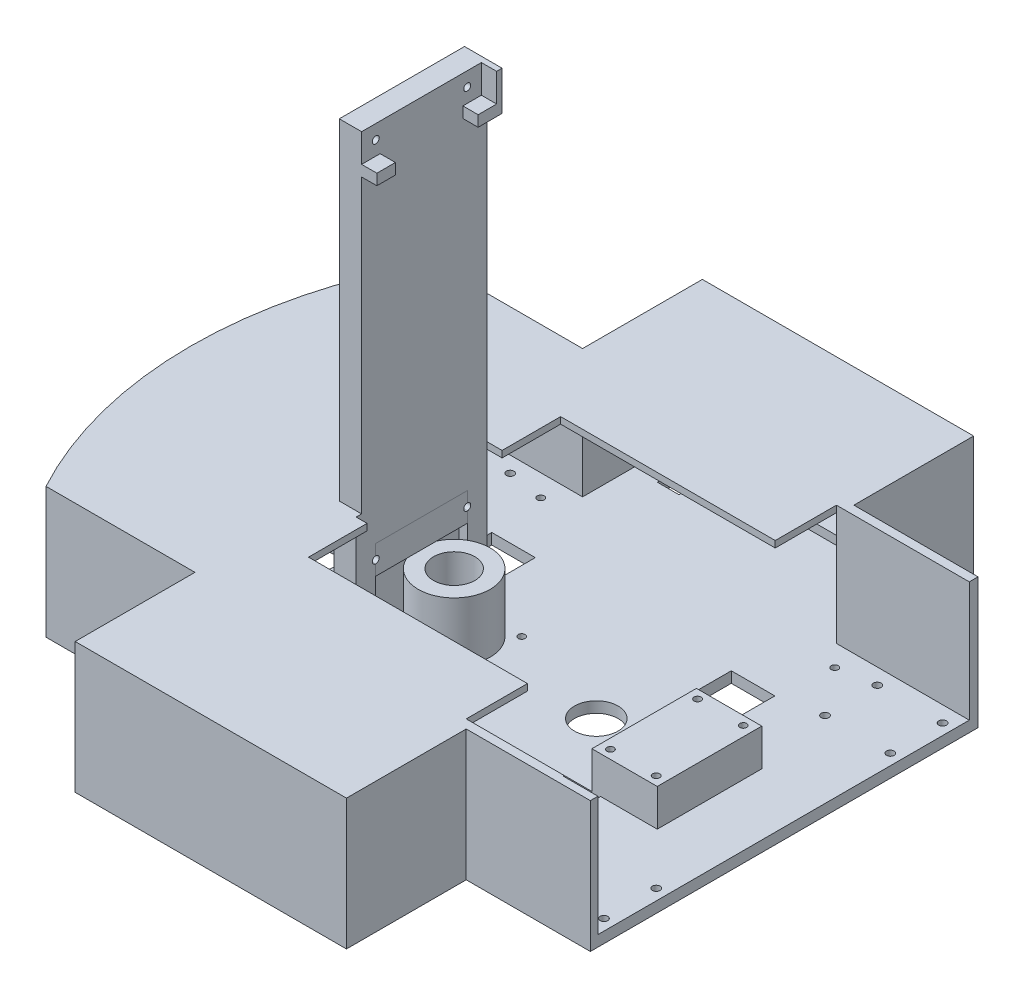
from build123d import *
from build123d.topology import SkipClean

# Parameters (mm, degrees)
SKETCH_1_R                  = 1.75
EXTRUDE_1_DEPTH             = 5
SKETCH_2_W                  = 20
SKETCH_2_H                  = 20
CUT_EXTRUDE_1_DEPTH         = 205.697931991
CUT_EXTRUDE_3_DEPTH         = 205.697931991
CUT_EXTRUDE_3_DEPTH_BACK    = 205.697931991
SKETCH_4_R                  = 1.6
CUT_EXTRUDE_4_DEPTH         = 205.697931991
CUT_EXTRUDE_4_DEPTH_BACK    = 205.697931991
SKETCH_5_R                  = 11
SKETCH_5_R_2                = 1.6
EXTRUDE_2_DEPTH             = 23.8
SKETCH_9_R                  = 16.5
SKETCH_9_R_2                = 11
EXTRUDE_3_DEPTH             = 2
SKETCH_10_R                 = 16.5
SKETCH_10_R_2               = 9.5
EXTRUDE_4_DEPTH             = 25
SKETCH_11_W                 = 10.25
SKETCH_11_H                 = 55
EXTRUDE_5_DEPTH             = 40
CUT_EXTRUDE_7_DEPTH         = 215.351774803
CUT_EXTRUDE_7_DEPTH_BACK    = 40
EXTRUDE_6_OUTLINE_W         = 42.3
EXTRUDE_6_OUTLINE_H         = 13
EXTRUDE_6_DEPTH             = 4
SKETCH_14_4_R               = 1.6
CUT_EXTRUDE_8_DEPTH         = 4
EXTRUDE_8_REACH             = 211.526
SKETCH_17_W                 = 10.25
SKETCH_17_H                 = 167
EXTRUDE_8_DIRECTION_2_REACH = 211.526
CUT_EXTRUDE_9_DEPTH         = 322.182257959
CUT_EXTRUDE_9_DEPTH_BACK    = 322.182257959
SKETCH_18_R                 = 1.6
SKETCH_21_W                 = 10.25
SKETCH_21_H                 = 2.5
EXTRUDE_9_DEPTH             = 207
EXTRUDE_10_DEPTH            = 7
SKETCH_24_W                 = 38
SKETCH_24_H                 = 5
CUT_EXTRUDE_11_DEPTH        = 7
EXTRUDE_START               = -5
EXTRUDE_11_DEPTH            = 60
SKETCH_28_R                 = 10
CUT_EXTRUDE_12_DEPTH        = 60
CUT_EXTRUDE_13_DEPTH        = 326.395266288
CUT_EXTRUDE_13_DEPTH_BACK   = 326.395266288
SKETCH_30_W                 = 70
SKETCH_30_H                 = 157
CUT_EXTRUDE_15_DEPTH        = 55
SKETCH_31_W                 = 65
SKETCH_31_H                 = 154
CUT_EXTRUDE_17_DEPTH        = 10
SKETCH_32_R                 = 1.6
CUT_EXTRUDE_18_DEPTH        = 10
EXTRUDE_START_2             = 17
SKETCH_32_3_W               = 30
SKETCH_32_3_H               = 48
SKETCH_32_3_R               = 1.6
EXTRUDE_12_DEPTH            = 17
CUT_EXTRUDE_START           = -78.8
SKETCH_33_W                 = 25.229470945
SKETCH_33_H                 = 5.5
CUT_EXTRUDE_19_DEPTH        = 230.8
CUT_EXTRUDE_21_DEPTH        = 296.078399089
CUT_EXTRUDE_21_DEPTH_BACK   = 296.078399089
SKETCH_36_W                 = 40
SKETCH_36_H                 = 4
SKETCH_36_W_2               = 10
SKETCH_36_H_2               = 20
EXTRUDE_13_DEPTH            = 3
SKETCH_41_W                 = 16.449480849
SKETCH_41_H                 = 36.538138877
SKETCH_41_W_2               = 17.593682818
SKETCH_41_H_2               = 32.002178069
CUT_EXTRUDE_23_DEPTH        = 60
CUT_EXTRUDE_24_DEPTH        = 260.473046016
CUT_EXTRUDE_24_DEPTH_BACK   = 260.473046016
SKETCH_42_W                 = 21.982294934
SKETCH_42_H                 = 16.041134141


# Read off the part's stored shape, not the designer's step: 凸台-拉伸6
with BuildPart() as part:
    # 草图1 → 凸台-拉伸1 (new body)
    with BuildSketch(Plane(origin=(0, 0, 0), x_dir=(1, 0, 0), z_dir=(0, 1, 0))):
        with BuildLine():
            Line((-62.281940226, 140), (-62.281940226, 85))
            Line((-62.281940226, 85), (-128.281940226, 85))
            ThreePointArc((-128.281940226, 85), (-149.252280925, 0), (-128.281940226, -85))
            Line((-128.281940226, -85), (-62.281940226, -85))
            Line((-62.281940226, -85), (-62.281940226, -140))
            Line((-62.281940226, -140), (62.281940226, -140))
            Line((62.281940226, -140), (62.281940226, -85))
            Line((62.281940226, -85), (128.281940226, -85))
            ThreePointArc((128.281940226, -85), (149.252280925, 0), (128.281940226, 85))
            Line((128.281940226, 85), (62.281940226, 85))
            Line((62.281940226, 85), (62.281940226, 140))
            Line((62.281940226, 140), (0, 140))
            Line((0, 140), (-62.281940226, 140))
        make_face()
        with Locations(Location((-84.281940226, 77.75, 0), (0, 0, 270))):
            Circle(SKETCH_1_R, mode=Mode.SUBTRACT)
        with Locations(Location((-114.281940226, 77.75, 0), (0, 0, 270))):
            Circle(SKETCH_1_R, mode=Mode.SUBTRACT)
        with Locations(Location((-114.281940226, 53.75, 0), (0, 0, 270))):
            Circle(SKETCH_1_R, mode=Mode.SUBTRACT)
        with Locations(Location((-84.281940226, 53.75, 0), (0, 0, 270))):
            Circle(SKETCH_1_R, mode=Mode.SUBTRACT)
        with Locations(Location((-84.281940226, -53.75, 0), (0, 0, 90))):
            Circle(SKETCH_1_R, mode=Mode.SUBTRACT)
        with Locations(Location((-114.281940226, -53.75, 0), (0, 0, 90))):
            Circle(SKETCH_1_R, mode=Mode.SUBTRACT)
        with Locations(Location((-114.281940226, -77.75, 0), (0, 0, 90))):
            Circle(SKETCH_1_R, mode=Mode.SUBTRACT)
        with Locations(Location((-84.281940226, -77.75, 0), (0, 0, 90))):
            Circle(SKETCH_1_R, mode=Mode.SUBTRACT)
        with Locations(Location((84.281940226, -77.75, 0), (0, 0, 270))):
            Circle(SKETCH_1_R, mode=Mode.SUBTRACT)
        with Locations(Location((114.281940226, -77.75, 0), (0, 0, 270))):
            Circle(SKETCH_1_R, mode=Mode.SUBTRACT)
        with Locations(Location((114.281940226, -53.75, 0), (0, 0, 270))):
            Circle(SKETCH_1_R, mode=Mode.SUBTRACT)
        with Locations(Location((84.281940226, -53.75, 0), (0, 0, 270))):
            Circle(SKETCH_1_R, mode=Mode.SUBTRACT)
        with Locations(Location((84.281940226, 53.75, 0), (0, 0, 90))):
            Circle(SKETCH_1_R, mode=Mode.SUBTRACT)
        with Locations(Location((114.281940226, 53.75, 0), (0, 0, 90))):
            Circle(SKETCH_1_R, mode=Mode.SUBTRACT)
        with Locations(Location((114.281940226, 77.75, 0), (0, 0, 90))):
            Circle(SKETCH_1_R, mode=Mode.SUBTRACT)
        with Locations(Location((84.281940226, 77.75, 0), (0, 0, 90))):
            Circle(SKETCH_1_R, mode=Mode.SUBTRACT)
    extrude(amount=EXTRUDE_1_DEPTH)

    # 草图2 → 切除-拉伸1 (cut, through all)
    with BuildSketch(Plane(origin=(0, 5, 0), x_dir=(1, 0, 0), z_dir=(0, 1, 0))):
        with Locations((-55, -40)):
            Rectangle(SKETCH_2_W, SKETCH_2_H)
        with Locations((-55, 40)):
            Rectangle(SKETCH_2_W, SKETCH_2_H)
        with Locations((55, -40)):
            Rectangle(SKETCH_2_W, SKETCH_2_H)
        with Locations((55, 40)):
            Rectangle(SKETCH_2_W, SKETCH_2_H)
    extrude(amount=-CUT_EXTRUDE_1_DEPTH, mode=Mode.SUBTRACT)

    # 草图4 → 切除-拉伸3 (cut, two sides: drawn at the far end of the back side and taken through both)
    with BuildSketch(Plane.XZ.offset(-CUT_EXTRUDE_3_DEPTH_BACK)):
        with Locations(Location((-67.5, 75, 0), (0, 0, 270))):
            Circle(SKETCH_4_R)
        with Locations(Location((67.5, 75, 0), (0, 0, 270))):
            Circle(SKETCH_4_R)
        with Locations(Location((-67.5, -75, 0), (0, 0, 270))):
            Circle(SKETCH_4_R)
        with Locations(Location((67.5, -75, 0), (0, 0, 270))):
            Circle(SKETCH_4_R)
    extrude(amount=CUT_EXTRUDE_3_DEPTH + CUT_EXTRUDE_3_DEPTH_BACK, mode=Mode.SUBTRACT)

    # 草图5 → 切除-拉伸4 (cut, two sides: drawn at the far end of the back side and taken through both)
    with BuildSketch(Plane.XZ.offset(-CUT_EXTRUDE_4_DEPTH_BACK)):
        with Locations(Location((-32.252280925, 0, 0), (0, 0, 270))):
            Circle(SKETCH_5_R)
        with Locations(Location((-16.752280925, -15.5, 0), (0, 0, 270))):
            Circle(SKETCH_5_R_2)
        with Locations(Location((-47.752280925, -15.5, 0), (0, 0, 270))):
            Circle(SKETCH_5_R_2)
        with Locations(Location((-47.752280925, 15.5, 0), (0, 0, 270))):
            Circle(SKETCH_5_R_2)
        with Locations(Location((-16.752280925, 15.5, 0), (0, 0, 270))):
            Circle(SKETCH_5_R_2)
    extrude(amount=CUT_EXTRUDE_4_DEPTH + CUT_EXTRUDE_4_DEPTH_BACK, mode=Mode.SUBTRACT)



with BuildPart() as body_2:
    # 草图6 → 凸台-拉伸2 (new body)
    with BuildSketch(Plane(origin=(0, 5, 0), x_dir=(1, 0, 0), z_dir=(0, 1, 0))):
        Polygon((-57.502280925, 21.25), (-53.502280925, 21.25), (-11.002280925, 21.25), (-11.002280925, -21.25), (-53.502280925, -21.25), (-57.502280925, -21.25), (-57.502280925, -25.25), (-7.002280925, -25.25), (-7.002280925, 25.25), (-57.502280925, 25.25), align=None)
    extrude(amount=-EXTRUDE_2_DEPTH)


with BuildPart() as part_1:
    with SkipClean():  # the faces are left unmerged after this step: merging them gives an invalid solid
        add(part.part)

        add(body_2.part)  # 凸台-拉伸3 merges body 2
        # 草图9 → 凸台-拉伸3 (add)
        with BuildSketch(Plane(origin=(0, 5, 0), x_dir=(1, 0, 0), z_dir=(0, 1, 0))):
            with Locations(Location((-32.252280925, 0, 0), (0, 0, 270))):
                Circle(SKETCH_9_R)
            with Locations(Location((-32.252280925, 0, 0), (0, 0, 270))):
                Circle(SKETCH_9_R_2, mode=Mode.SUBTRACT)
        extrude(amount=EXTRUDE_3_DEPTH)

    # 草图10 → 凸台-拉伸4 (add)
    with SkipClean():  # the faces are left unmerged after this step: merging them gives an invalid solid
        with BuildSketch(Plane(origin=(0, 7, 0), x_dir=(1, 0, 0), z_dir=(0, 1, 0))):
            with Locations(Location((-32.252280925, 0, 0), (0, 0, 270))):
                Circle(SKETCH_10_R)
            with Locations(Location((-32.252280925, 0, 0), (0, 0, 270))):
                Circle(SKETCH_10_R_2, mode=Mode.SUBTRACT)
        extrude(amount=EXTRUDE_4_DEPTH)

    # 草图11 → 凸台-拉伸5 (add)
    with SkipClean():  # the faces are left unmerged after this step: merging them gives an invalid solid
        with BuildSketch(Plane(origin=(0, 5, 0), x_dir=(1, 0, 0), z_dir=(0, 1, 0))):
            with Locations((-52.377280925, 0)):
                Rectangle(SKETCH_11_W, SKETCH_11_H)
        extrude(amount=EXTRUDE_5_DEPTH)

    # 草图13 → 切除-拉伸7 (cut, two sides: drawn at the far end of the back side and taken through both)
    with SkipClean():  # the faces are left unmerged after this step: merging them gives an invalid solid
        with BuildSketch(Plane(origin=(0, 45, 0), x_dir=(1, 0, 0), z_dir=(0, 1, 0)).offset(-CUT_EXTRUDE_7_DEPTH_BACK)):
            Polygon((-51.252280925, 21.15), (-51.252280925, 0), (-47.252280925, 0), (-47.252280925, 13.980131585), (-47.252280925, 17.019868415), (-47.252280925, 21.15), align=None)
            Polygon((-47.252280925, 0), (-51.252280925, 0), (-51.252280925, -21.15), (-47.252280925, -21.15), (-47.252280925, -17.019868415), (-47.252280925, -13.980131585), align=None)
        extrude(amount=CUT_EXTRUDE_7_DEPTH + CUT_EXTRUDE_7_DEPTH_BACK, mode=Mode.SUBTRACT)


with BuildPart() as body_2_2:
    # 凸台-拉伸6 outline → 凸台-拉伸6 (new body)
    with BuildSketch(Plane(origin=(-51.252280925, 0, 0), x_dir=(0, 0, -1), z_dir=(1, 0, 0))):
        with Locations((0, 38.5)):
            Rectangle(EXTRUDE_6_OUTLINE_W, EXTRUDE_6_OUTLINE_H)
    extrude(amount=EXTRUDE_6_DEPTH)


with BuildPart() as cut_extrude_8_tool:
    # 草图14<4> → 切除-拉伸8 (new body)
    with SkipClean():  # the faces are left unmerged after this step: merging them gives an invalid solid
        with BuildSketch(Plane(origin=(-51.252280925, 0, 0), x_dir=(0, 0, -1), z_dir=(1, 0, 0))):
            with Locations((-21, 38.5)):
                Circle(SKETCH_14_4_R)
            with Locations((21, 38.5)):
                Circle(SKETCH_14_4_R)
        extrude(amount=CUT_EXTRUDE_8_DEPTH)


with BuildPart() as part_2:
    with SkipClean():  # the faces are left unmerged after this step: merging them gives an invalid solid
        add(part_1.part)

        # 切除-拉伸8: cut by cut_extrude_8_tool
        add(cut_extrude_8_tool.part, mode=Mode.SUBTRACT)


with BuildPart() as body_2_2_1:
    with SkipClean():  # the faces are left unmerged after this step: merging them gives an invalid solid
        add(body_2_2.part)

        # 切除-拉伸8: cut by cut_extrude_8_tool
        add(cut_extrude_8_tool.part, mode=Mode.SUBTRACT)


with BuildPart() as body_3:

    # 凸台-拉伸8: up to this face of the body (flat: up to its plane)
    extrude_8_end = Plane(part_2.part.faces().sort_by_distance((-52.377280925, 25, 27.5))[0])
    # 草图17 → 凸台-拉伸8 (new, up to the picked face)
    with BuildSketch(Plane.XY, mode=Mode.PRIVATE) as extrude_8_sk1:
        with Locations((-52.377280925, 128.5)):
            Rectangle(SKETCH_17_W, SKETCH_17_H)
    extrude_8_tool1 = split(extrude(extrude_8_sk1.sketch, amount=EXTRUDE_8_REACH, mode=Mode.PRIVATE), bisect_by=extrude_8_end, keep=Keep.BOTH, mode=Mode.PRIVATE)
    add(extrude_8_tool1.solids().sort_by(Axis((-52.377281, 128.5, 0), (0, 0, 1)))[0])


    # 凸台-拉伸8 direction 2: up to this face of the body (flat: up to its plane)
    extrude_8_direction_2_end = Plane(part_2.part.faces().sort_by_distance((-52.377280925, 25, -27.5))[0])
    # 草图17 → 凸台-拉伸8 direction 2 (add, up to the picked face)
    with BuildSketch(Plane.XY, mode=Mode.PRIVATE) as extrude_8_direction_2_sk1:
        with Locations((-52.377280925, 128.5)):
            Rectangle(SKETCH_17_W, SKETCH_17_H)
    extrude_8_direction_2_tool1 = split(extrude(extrude_8_direction_2_sk1.sketch, amount=-EXTRUDE_8_DIRECTION_2_REACH, mode=Mode.PRIVATE), bisect_by=extrude_8_direction_2_end, keep=Keep.BOTH, mode=Mode.PRIVATE)
    add(extrude_8_direction_2_tool1.solids().sort_by(Axis((-52.377281, 128.5, 0), (0, 0, -1)))[0])

    # 草图18 → 切除-拉伸9 (cut, two sides: drawn at the far end of the back side and taken through both)
    with BuildSketch(Plane(origin=(-47.252280925, 0, 0), x_dir=(0, 0, -1), z_dir=(1, 0, 0)).offset(-CUT_EXTRUDE_9_DEPTH_BACK)):
        with Locations((-21, 205.5)):
            Circle(SKETCH_18_R)
        with Locations((21, 205.5)):
            Circle(SKETCH_18_R)
    extrude(amount=CUT_EXTRUDE_9_DEPTH + CUT_EXTRUDE_9_DEPTH_BACK, mode=Mode.SUBTRACT)


with BuildPart() as part_3:
    with SkipClean():  # the faces are left unmerged after this step: merging them gives an invalid solid
        add(part_2.part)

        add(body_3.part)  # 凸台-拉伸9 merges body 3
        # 草图21 → 凸台-拉伸9 (add)
        with BuildSketch(Plane(origin=(0, 5, 0), x_dir=(1, 0, 0), z_dir=(0, 1, 0))):
            with Locations((-52.377280925, 28.75)):
                Rectangle(SKETCH_21_W, SKETCH_21_H)
            with Locations((-52.377280925, -28.75)):
                Rectangle(SKETCH_21_W, SKETCH_21_H)
        extrude(amount=EXTRUDE_9_DEPTH)

    # 草图23 → 凸台-拉伸10 (add)
    with SkipClean():  # the faces are left unmerged after this step: merging them gives an invalid solid
        with BuildSketch(Plane(origin=(-47.252280925, 0, 0), x_dir=(0, 0, -1), z_dir=(1, 0, 0))):
            Polygon((-30, 212), (-30, 194), (30, 194), (30, 212), (27.5, 212), (27.5, 199), (-27.5, 199), (-27.5, 212), align=None)
        extrude(amount=EXTRUDE_10_DEPTH)

    # 草图24 → 切除-拉伸11 (cut)
    with SkipClean():  # the faces are left unmerged after this step: merging them gives an invalid solid
        with BuildSketch(Plane(origin=(-40.252280925, 0, 0), x_dir=(0, 0, -1), z_dir=(1, 0, 0))):
            with Locations((0, 196.5)):
                Rectangle(SKETCH_24_W, SKETCH_24_H)
        extrude(amount=-CUT_EXTRUDE_11_DEPTH, mode=Mode.SUBTRACT)

    # 草图28 → 切除-拉伸12 (cut)
    with SkipClean():  # the faces are left unmerged after this step: merging them gives an invalid solid
        with BuildSketch(Plane(origin=(0, 5, 0), x_dir=(1, 0, 0), z_dir=(0, 1, 0))):
            with Locations(Location((-97.502280925, 0, 0), (0, 0, 270))):
                Circle(SKETCH_28_R)
            with Locations(Location((32.997719075, 0, 0), (0, 0, 270))):
                Circle(SKETCH_28_R)
        extrude(amount=-CUT_EXTRUDE_12_DEPTH, mode=Mode.SUBTRACT)

    # 草图29 → 切除-拉伸13 (cut, two sides: drawn at the far end of the back side and taken through both)
    with SkipClean():  # the faces are left unmerged after this step: merging them gives an invalid solid
        with BuildSketch(Plane(origin=(-47.252280925, 0, 0), x_dir=(0, 0, -1), z_dir=(1, 0, 0)).offset(-CUT_EXTRUDE_13_DEPTH_BACK)):
            Polygon((-27.5, 212), (-27.5, 60), (-34.892140689, 60), (-34.892140689, 217.760652355), align=None)
        extrude(amount=CUT_EXTRUDE_13_DEPTH + CUT_EXTRUDE_13_DEPTH_BACK, mode=Mode.SUBTRACT)


with BuildPart() as body_3_2:
    # 草图27 → 凸台-拉伸11 (new body)
    with BuildSketch(Plane(origin=(0, 5, 0), x_dir=(1, 0, 0), z_dir=(0, 1, 0)).offset(EXTRUDE_START)):
        with BuildLine():
            Line((62.281940226, 144), (-62.281940226, 144))
            Line((-62.281940226, 144), (-62.281940226, 89))
            Line((-62.281940226, 89), (-130.68104163, 89))
            ThreePointArc((-130.68104163, 89), (-153.252280925, 0), (-130.68104163, -89))
            Line((-130.68104163, -89), (-62.281940226, -89))
            Line((-62.281940226, -89), (-62.281940226, -144))
            Line((-62.281940226, -144), (62.281940226, -144))
            Line((62.281940226, -144), (62.281940226, -89))
            Line((62.281940226, -89), (130.68104163, -89))
            ThreePointArc((130.68104163, -89), (153.252280925, 0), (130.68104163, 89))
            Line((130.68104163, 89), (62.281940226, 89))
            Line((62.281940226, 89), (62.281940226, 144))
        make_face()
        with BuildLine():
            Line((-58.281940226, -140), (-58.281940226, -85))
            Line((-58.281940226, -85), (-128.281940226, -85))
            ThreePointArc((-128.281940226, -85), (-149.252280925, 0), (-128.281940226, 85))
            Line((-128.281940226, 85), (-58.281940226, 85))
            Line((-58.281940226, 85), (-58.281940226, 140))
            Line((-58.281940226, 140), (58.281940226, 140))
            Line((58.281940226, 140), (58.281940226, 85))
            Line((58.281940226, 85), (128.281940226, 85))
            ThreePointArc((128.281940226, 85), (149.252280925, 0), (128.281940226, -85))
            Line((128.281940226, -85), (58.281940226, -85))
            Line((58.281940226, -85), (58.281940226, -140))
            Line((58.281940226, -140), (-58.281940226, -140))
        make_face(mode=Mode.SUBTRACT)
    extrude(amount=EXTRUDE_11_DEPTH)

    # 草图30 → 切除-拉伸15 (cut)
    with BuildSketch(Plane(origin=(0, 60, 0), x_dir=(1, 0, 0), z_dir=(0, 1, 0))):
        with Locations((138.252280925, -7)):
            Rectangle(SKETCH_30_W, SKETCH_30_H)
    extrude(amount=-CUT_EXTRUDE_15_DEPTH, mode=Mode.SUBTRACT)


with BuildPart() as cut_extrude_17_tool:
    # 草图31 → 切除-拉伸17 (new body)
    with SkipClean():  # the faces are left unmerged after this step: merging them gives an invalid solid
        with BuildSketch(Plane(origin=(0, 5, 0), x_dir=(1, 0, 0), z_dir=(0, 1, 0))):
            with Locations((151.781940226, -8)):
                Rectangle(SKETCH_31_W, SKETCH_31_H)
        extrude(amount=-CUT_EXTRUDE_17_DEPTH)


with BuildPart() as part_4:
    with SkipClean():  # the faces are left unmerged after this step: merging them gives an invalid solid
        add(part_3.part)

        # 切除-拉伸17: cut by cut_extrude_17_tool
        add(cut_extrude_17_tool.part, mode=Mode.SUBTRACT)

    # 草图32 → 切除-拉伸18 (cut)
    with SkipClean():  # the faces are left unmerged after this step: merging them gives an invalid solid
        with BuildSketch(Plane(origin=(0, 5, 0), x_dir=(1, 0, 0), z_dir=(0, 1, 0))):
            with Locations(Location((65.497719075, 14, 0), (0, 0, 270))):
                Circle(SKETCH_32_R)
            with Locations(Location((86.497719075, 14, 0), (0, 0, 270))):
                Circle(SKETCH_32_R)
            with Locations(Location((65.497719075, -26, 0), (0, 0, 270))):
                Circle(SKETCH_32_R)
            with Locations(Location((86.497719075, -26, 0), (0, 0, 270))):
                Circle(SKETCH_32_R)
        extrude(amount=-CUT_EXTRUDE_18_DEPTH, mode=Mode.SUBTRACT)


with BuildPart() as body_3_2_1:
    with SkipClean():  # the faces are left unmerged after this step: merging them gives an invalid solid
        add(body_3_2.part)

        # 切除-拉伸17: cut by cut_extrude_17_tool
        add(cut_extrude_17_tool.part, mode=Mode.SUBTRACT)


    with SkipClean():  # the faces are left unmerged after this step: merging them gives an invalid solid
        add(part_4.part)  # 凸台-拉伸12 merges part
        # 草图32<3> → 凸台-拉伸12 (add)
        with BuildSketch(Plane(origin=(0, 5, 0), x_dir=(1, 0, 0), z_dir=(0, 1, 0)).offset(EXTRUDE_START_2)):
            with Locations((75.997719075, -6)):
                Rectangle(SKETCH_32_3_W, SKETCH_32_3_H)
            with Locations(Location((65.497719075, 14, 0), (0, 0, 270))):
                Circle(SKETCH_32_3_R, mode=Mode.SUBTRACT)
            with Locations(Location((65.497719075, -26, 0), (0, 0, 270))):
                Circle(SKETCH_32_3_R, mode=Mode.SUBTRACT)
            with Locations(Location((86.497719075, -26, 0), (0, 0, 270))):
                Circle(SKETCH_32_3_R, mode=Mode.SUBTRACT)
            with Locations(Location((86.497719075, 14, 0), (0, 0, 270))):
                Circle(SKETCH_32_3_R, mode=Mode.SUBTRACT)
        extrude(amount=-EXTRUDE_12_DEPTH)

    # 草图33 → 切除-拉伸19 (cut)
    with SkipClean():  # the faces are left unmerged after this step: merging them gives an invalid solid
        with BuildSketch(Plane(origin=(0, 60, 0), x_dir=(1, 0, 0), z_dir=(0, 1, 0)).offset(CUT_EXTRUDE_START)):
            with Locations((131.896675699, 71.75)):
                Rectangle(SKETCH_33_W, SKETCH_33_H)
        extrude(amount=CUT_EXTRUDE_19_DEPTH, mode=Mode.SUBTRACT)

    # 草图36 → 切除-拉伸21 (cut, two sides: drawn at the far end of the back side and taken through both)
    with SkipClean():  # the faces are left unmerged after this step: merging them gives an invalid solid
        with BuildSketch(Plane(origin=(0, 5, 0), x_dir=(1, 0, 0), z_dir=(0, 1, 0)).offset(-CUT_EXTRUDE_21_DEPTH_BACK)):
            with Locations((0, 126)):
                Rectangle(SKETCH_36_W, SKETCH_36_H)
            with Locations((0, -126)):
                Rectangle(SKETCH_36_W, SKETCH_36_H)
            with Locations((-42, -118)):
                Rectangle(SKETCH_36_W_2, SKETCH_36_H_2)
            with Locations((42, -118)):
                Rectangle(SKETCH_36_W_2, SKETCH_36_H_2)
            with Locations((-42, 118)):
                Rectangle(SKETCH_36_W_2, SKETCH_36_H_2)
            with Locations((42, 118)):
                Rectangle(SKETCH_36_W_2, SKETCH_36_H_2)
        extrude(amount=CUT_EXTRUDE_21_DEPTH + CUT_EXTRUDE_21_DEPTH_BACK, mode=Mode.SUBTRACT)

    # 草图39 → 凸台-拉伸13 (add)
    with SkipClean():  # the faces are left unmerged after this step: merging them gives an invalid solid
        with BuildSketch(Plane(origin=(0, 60, 0), x_dir=(1, 0, 0), z_dir=(0, 1, 0))):
            with BuildLine():
                Line((-65.9, 85), (-58.281940226, 85))
                Line((-58.281940226, 85), (-58.281940226, 140))
                Line((-58.281940226, 140), (58.281940226, 140))
                Line((58.281940226, 140), (58.281940226, 85))
                Line((58.281940226, 85), (128.281940226, 85))
                ThreePointArc((128.281940226, 85), (130.913631273, 79.790688898), (133.377638356, 74.5))
                Line((133.377638356, 74.5), (137.74883775, 74.5))
                ThreePointArc((137.74883775, 74.5), (134.371568454, 81.826346219), (130.68104163, 89))
                Line((130.68104163, 89), (62.281940226, 89))
                Line((62.281940226, 89), (62.281940226, 144))
                Line((62.281940226, 144), (-62.281940226, 144))
                Line((-62.281940226, 144), (-62.281940226, 89))
                Line((-62.281940226, 89), (-130.68104163, 89))
                ThreePointArc((-130.68104163, 89), (-153.252280925, 0), (-130.68104163, -89))
                Line((-130.68104163, -89), (-62.281940226, -89))
                Line((-62.281940226, -89), (-62.281940226, -144))
                Line((-62.281940226, -144), (62.281940226, -144))
                Line((62.281940226, -144), (62.281940226, -89))
                Line((62.281940226, -89), (130.68104163, -89))
                ThreePointArc((130.68104163, -89), (131.615101375, -87.254900885), (132.530612932, -85.5))
                Line((132.530612932, -85.5), (103.252280925, -85.5))
                Line((103.252280925, -85.5), (103.252280925, -85))
                Line((103.252280925, -85), (58.281940226, -85))
                Line((58.281940226, -85), (58.281940226, -140))
                Line((58.281940226, -140), (-58.281940226, -140))
                Line((-58.281940226, -140), (-58.281940226, -85))
                Line((-58.281940226, -85), (-65.9, -85))
                Line((-65.9, -85), (-128.281940226, -85))
                ThreePointArc((-128.281940226, -85), (-149.252280925, 0), (-128.281940226, 85))
                Line((-128.281940226, 85), (-65.9, 85))
            make_face()
            with BuildLine():
                Line((-58.281940226, 140), (-58.281940226, 85))
                Line((-58.281940226, 85), (-65.9, 85))
                Line((-65.9, 85), (-128.281940226, 85))
                ThreePointArc((-128.281940226, 85), (-149.252280925, 0), (-128.281940226, -85))
                Line((-128.281940226, -85), (-65.9, -85))
                Line((-65.9, -85), (-58.281940226, -85))
                Line((-58.281940226, -85), (-58.281940226, -140))
                Line((-58.281940226, -140), (58.281940226, -140))
                Line((58.281940226, -140), (58.281940226, -85))
                Line((58.281940226, -85), (58.281940226, -56.886614593))
                Line((58.281940226, -56.886614593), (-42.252280925, -56.886614593))
                Line((-42.252280925, -56.886614593), (-42.252280925, -30))
                Line((-42.252280925, -30), (-57.502280925, -30))
                Line((-57.502280925, -30), (-57.502280925, 30))
                Line((-57.502280925, 30), (-40.252280925, 30))
                Line((-40.252280925, 30), (-40.252280925, 56.886614593))
                Line((-40.252280925, 56.886614593), (58.281940226, 56.886614593))
                Line((58.281940226, 56.886614593), (58.281940226, 85))
                Line((58.281940226, 85), (58.281940226, 140))
                Line((58.281940226, 140), (-58.281940226, 140))
            make_face()
        extrude(amount=-EXTRUDE_13_DEPTH)

    # 草图41 → 切除-拉伸23 (cut)
    with SkipClean():  # the faces are left unmerged after this step: merging them gives an invalid solid
        with BuildSketch(Plane(origin=(0, 60, 0), x_dir=(1, 0, 0), z_dir=(0, 1, 0))):
            with Locations((127.506680651, 82.879193063)):
                Rectangle(SKETCH_41_W, SKETCH_41_H)
            with Locations((128.078781635, -85.921384543)):
                Rectangle(SKETCH_41_W_2, SKETCH_41_H_2)
        extrude(amount=-CUT_EXTRUDE_23_DEPTH, mode=Mode.SUBTRACT)


with BuildPart() as cut_extrude_23_piece_1:
    # of the separate pieces the step leaves, piece 1, a body of its own (cut_extrude_23_pieces)
    add(body_3_2_1.part.solids().sort_by_distance((-47.252280925, 45, -21.15))[0])


with BuildPart() as cut_extrude_23_piece_2:
    # of the separate pieces the step leaves, piece 2, a body of its own (cut_extrude_23_pieces)
    add(body_3_2_1.part.solids().sort_by_distance((135.731421075, 57, -74.5))[0])

    # 草图42 → 切除-拉伸24 (cut, two sides: drawn at the far end of the back side and taken through both)
    with BuildSketch(Plane(origin=(0, 60, 0), x_dir=(1, 0, 0), z_dir=(0, 1, 0)).offset(-CUT_EXTRUDE_24_DEPTH_BACK)):
        with Locations((139.552694574, 77.977735408)):
            Rectangle(SKETCH_42_W, SKETCH_42_H)
    extrude(amount=CUT_EXTRUDE_24_DEPTH + CUT_EXTRUDE_24_DEPTH_BACK, mode=Mode.SUBTRACT)


solid = Compound([body_2_2_1.part, cut_extrude_23_piece_1.part])
